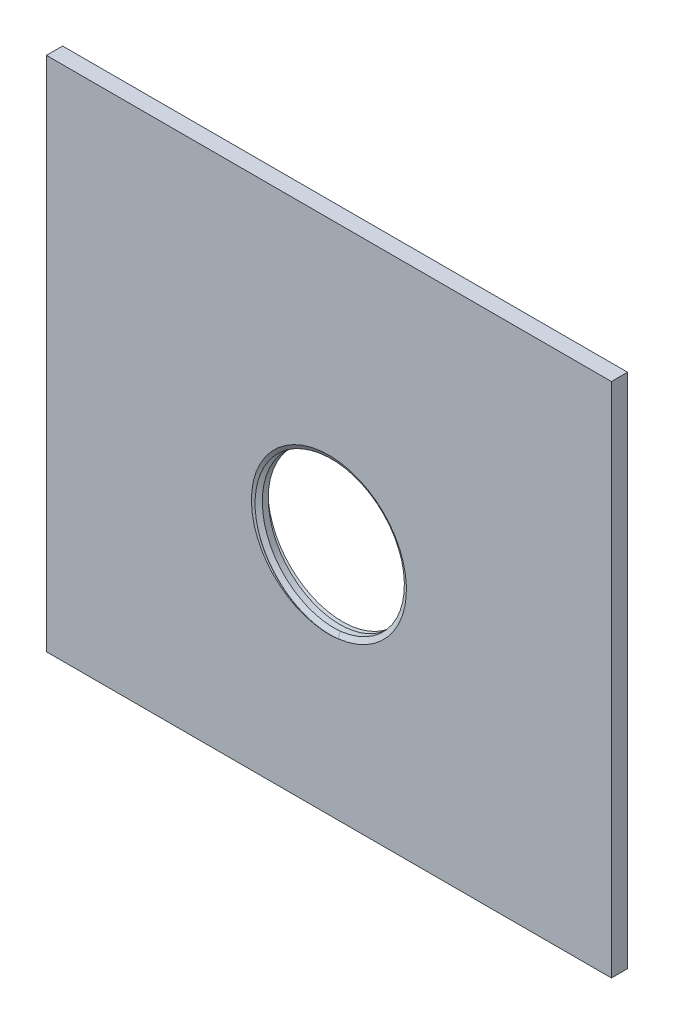
from build123d import *

# Parameters (mm, degrees)
SKETCH1_W           = 35
SKETCH1_H           = 35
BOSS_EXTRUDE1_DEPTH = 1
CUT_EXTRUDE1_REACH  = 51.508
SKETCH2_R           = 4.5
CUT_SWEEP9_PITCH    = 0.75
SKETCH26_W          = 35
SKETCH26_H          = 1
CUT_EXTRUDE4_DEPTH  = 3


with BuildPart() as part:
    # Sketch1 → Boss-Extrude1 (new body)
    with BuildSketch(Plane.XY):
        with Locations((17.5, 17.5)):
            Rectangle(SKETCH1_W, SKETCH1_H)
    extrude(amount=BOSS_EXTRUDE1_DEPTH)

    # Sketch2 → Cut-Extrude1 (cut, up to next)
    with BuildSketch(Plane.XY.offset(1), mode=Mode.PRIVATE) as cut_extrude1_sk1:
        with Locations((17.5, 17.5)):
            Circle(SKETCH2_R)
    cut_extrude1_tool1 = extrude(cut_extrude1_sk1.sketch, amount=-CUT_EXTRUDE1_REACH, mode=Mode.PRIVATE) & part.part
    add(cut_extrude1_tool1.solids().sort_by_distance((17.5, 17.5, 1))[0], mode=Mode.SUBTRACT)

    # Cut-Sweep9: the profile of Sketch22 profile screwed along a right-hand helix of 3 turns, 8 arcs to a turn; built about Z, then put on its axis
    cut_sweep9_z = Axis((0, 0, 0), (0, 0, 1))
    cut_sweep9_corners = [(4.4997, 0, -0.382379083), (4.4997, 0, 0.000173205), (4.801, 0, -0.173782431), (4.811, 0, -0.191102939), (4.801, 0, -0.208423447)]
    with BuildLine(mode=Mode.PRIVATE) as cut_sweep9_profile:
        Line(cut_sweep9_corners[0], cut_sweep9_corners[1])
        Line(cut_sweep9_corners[1], cut_sweep9_corners[2])
        Line(cut_sweep9_corners[4], cut_sweep9_corners[0])
        ThreePointArc((4.801, 0, -0.173782431), (4.808320508, 0, -0.181102939), (4.811, 0, -0.191102939))
        ThreePointArc((4.811, 0, -0.191102939), (4.808320508, 0, -0.201102939), (4.801, 0, -0.208423447))
    cut_sweep9_cap = Face(cut_sweep9_profile.wire())
    cut_sweep9_arcs = [((4.801, 0, -0.173782431), (4.811, 0, -0.179555934), (4.811, 0, -0.191102939), (1, 0.866025403784374, 1)), ((4.811, 0, -0.191102939), (4.811, 0, -0.202649944), (4.801, 0, -0.208423447), (1, 0.866025403784374, 1))]  # start, shoulder, end, weights
    cut_sweep9_turn_angles = [0, 22.5, 45, 67.5, 90, 112.5, 135, 157.5, 180, 202.5, 225, 247.5, 270, 292.5, 315, 337.5, 360]
    cut_sweep9_turn_weights = [1, 0.9238795325112867, 1, 0.9238795325112867, 1, 0.9238795325112867, 1, 0.9238795325112867, 1, 0.9238795325112867, 1, 0.9238795325112867, 1, 0.9238795325112867, 1, 0.9238795325112867, 1]
    cut_sweep9_turn_rails = [Edge.make_bspline([Vector(p[0], p[1], 0).rotate(cut_sweep9_z, cut_sweep9_turn_angles[k]) / cut_sweep9_turn_weights[k] + Vector(0, 0, p[2] + CUT_SWEEP9_PITCH * cut_sweep9_turn_angles[k] / 360) for k in range(17)], [0, 0, 0, 1, 1, 2, 2, 3, 3, 4, 4, 5, 5, 6, 6, 7, 7, 8, 8, 8], 2, cut_sweep9_turn_weights) for p in cut_sweep9_corners]
    cut_sweep9_turn_sides = [*[Face.make_surface_from_curves(cut_sweep9_turn_rails[p[0]], cut_sweep9_turn_rails[p[1]]) for p in [(0, 1), (1, 2), (4, 0)]], *[Face.make_bezier_surface([[Vector(p[j][0], p[j][1], 0).rotate(cut_sweep9_z, cut_sweep9_turn_angles[2 * i + k]) / cut_sweep9_turn_weights[2 * i + k] + Vector(0, 0, p[j][2] + CUT_SWEEP9_PITCH * cut_sweep9_turn_angles[2 * i + k] / 360) for k in range(3)] for j in range(3)], [[p[3][j] * cut_sweep9_turn_weights[2 * i + k] for k in range(3)] for j in range(3)]) for p in cut_sweep9_arcs for i in range(8)]]
    cut_sweep9 = Plane(origin=(17.5, 17.5, 1), x_dir=(1, 0, 0), z_dir=(0, 0, -1)) * Solid(Shell([*[p.moved(Location((0, 0, CUT_SWEEP9_PITCH * i))) for i in range(3) for p in cut_sweep9_turn_sides], cut_sweep9_cap, cut_sweep9_cap.rotate(cut_sweep9_z, 1080).moved(Location((0, 0, CUT_SWEEP9_PITCH * 1080 / 360)))]))
    add(cut_sweep9, mode=Mode.SUBTRACT)

    # Cut-Extrude2 cone 1 section (through the dimple's axis) → Cut-Extrude2 (revolve, cut)
    with BuildSketch(Plane(origin=(17.5, 17.5, 1), x_dir=(0, -1, 0), z_dir=(1, 0, 0))):
        Polygon((0, 0), (4.801, 0), (0, 2.771858642), align=None)
    revolve(axis=Axis((17.5, 17.5, 1), (0, 0, -1)), mode=Mode.SUBTRACT)

    # Cut-Extrude3 cone 1 section (through the dimple's axis) → Cut-Extrude3 (revolve, cut)
    with BuildSketch(Plane(origin=(17.5, 17.5, 0), x_dir=(0, 1, 0), z_dir=(1, 0, 0))):
        Polygon((0, 0), (4.801, 0), (0, 2.771858642), align=None)
    revolve(axis=Axis((17.5, 17.5, 0), (0, 0, 1)), mode=Mode.SUBTRACT)

    # Sketch26 → Cut-Extrude4 (cut)
    with BuildSketch(Plane.XZ):
        with Locations((17.5, 0.5)):
            Rectangle(SKETCH26_W, SKETCH26_H)
    extrude(amount=-CUT_EXTRUDE4_DEPTH, mode=Mode.SUBTRACT)


solid = part.part
